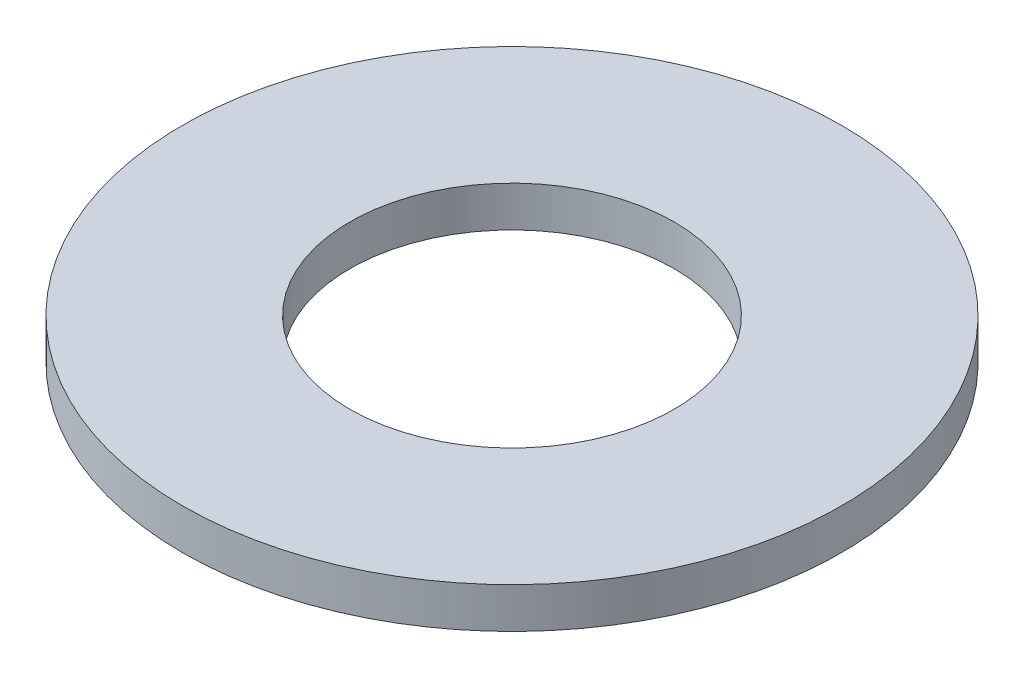
from build123d import *

# Parameters (mm, degrees)
SKETCH1_R           = 8.255
SKETCH1_R_2         = 4.064
BOSS_EXTRUDE1_DEPTH = 0.508


with BuildPart() as part:
    # Sketch1 → Boss-Extrude1 (new, symmetric)
    with BuildSketch(Plane(origin=(0, 0, 0), x_dir=(1, 0, 0), z_dir=(0, 1, 0))):
        Circle(SKETCH1_R)
        Circle(SKETCH1_R_2, mode=Mode.SUBTRACT)
    extrude(amount=BOSS_EXTRUDE1_DEPTH, both=True)


solid = part.part
